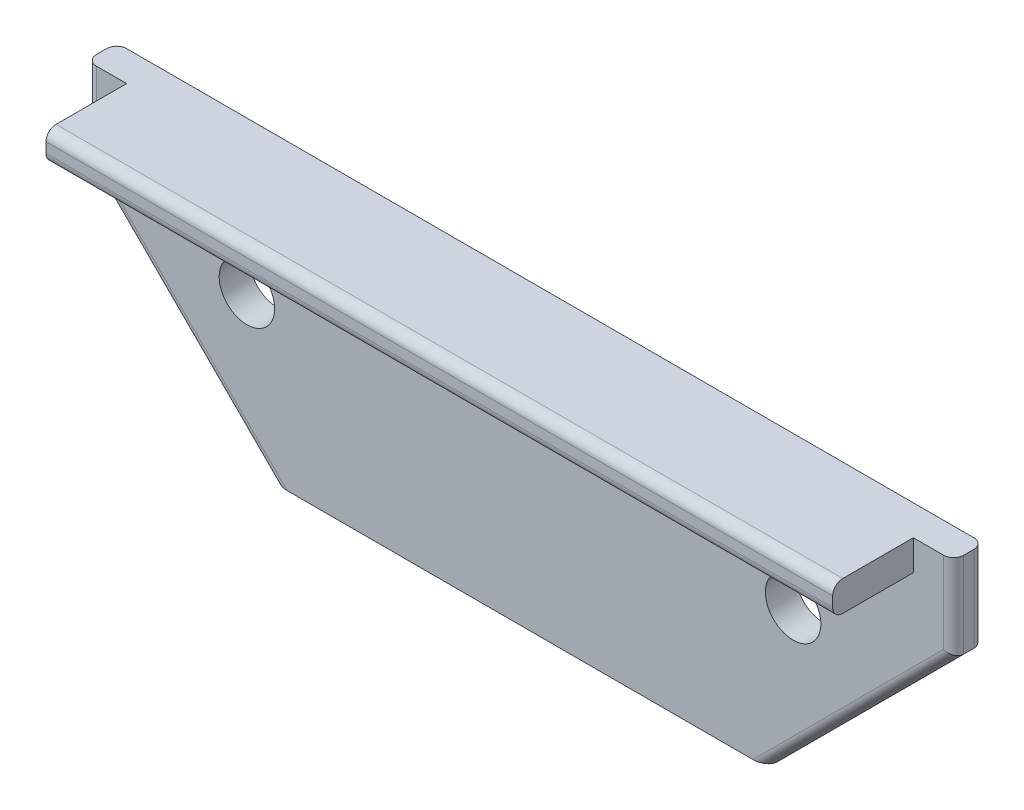
from build123d import *

# Parameters (mm, degrees)
BOSS_EXTRUDE1_DEPTH       = 9.525
SKETCH2_W                 = 247.649999748
SKETCH2_H                 = 9.52499999
BOSS_EXTRUDE2_DEPTH       = 25.4
M16_CLEARANCE_HOLE1_D     = 17.462499982
M16_CLEARANCE_HOLE1_DEPTH = 34.925
FILLET1_R                 = 3.175


with BuildPart() as part:
    # Sketch1 → Boss-Extrude1 (new body)
    with BuildSketch(Plane.XY.offset(-7.9375)):
        Polygon((136.524999861, 15.874999984), (136.524999861, 42.862499956), (-136.524999861, 42.862499956), (-136.524999861, 15.874999984), (-77.787499921, -42.862499956), (77.787499921, -42.862499956), align=None)
    extrude(amount=-BOSS_EXTRUDE1_DEPTH)

    # Sketch2 → Boss-Extrude2 (add)
    with BuildSketch(Plane.XY.offset(-7.9375)):
        with Locations((0, 38.099999961)):
            Rectangle(SKETCH2_W, SKETCH2_H)
    extrude(amount=BOSS_EXTRUDE2_DEPTH)

    # M16 Clearance Hole1
    with Locations(Plane(origin=(0, 0, -17.4625), x_dir=(-1, 0, 0), z_dir=(0, 0, -1))):
        with Locations((-85.978999912, 4.762499995), (85.978999912, 4.762499995)):
            Hole(M16_CLEARANCE_HOLE1_D / 2, depth=M16_CLEARANCE_HOLE1_DEPTH)

    # Fillet1
    fillet1_edges = [part.edges().sort_by_distance(p)[0] for p in [
        (-107.156249891, -13.493749986, -17.4625),
        (-136.524999861, 29.36874997, -17.4625),
        (-136.524999861, 29.36874997, -7.9375),
        (-107.156249891, -13.493749986, -7.9375),
        (136.524999861, 29.36874997, -17.4625),
        (107.156249891, -13.493749986, -17.4625),
        (0, 42.862499956, 17.4625),
        (107.156249891, -13.493749986, -7.9375),
        (136.524999861, 29.36874997, -7.9375),
        (0, 33.337499966, 17.4625),
    ]]
    fillet(fillet1_edges, radius=FILLET1_R)


solid = part.part
